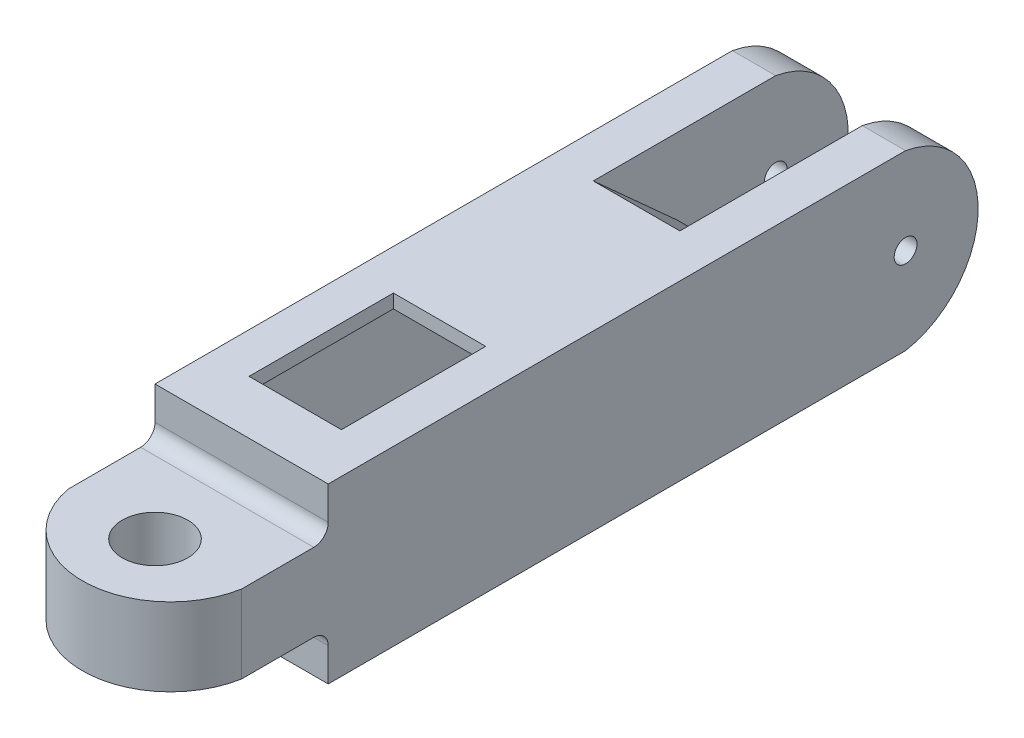
from build123d import *

# Parameters (mm, degrees)
SKETCH2_W               = 60
SKETCH2_H               = 60
BOSS_EXTRUDE1_DEPTH     = 170
SKETCH3_W               = 15
SKETCH3_H               = 60
BOSS_EXTRUDE2_DEPTH     = 30
BOSS_EXTRUDE3_DEPTH     = 15
BOSS_EXTRUDE4_START     = -15
BOSS_EXTRUDE4_DEPTH     = 15
SKETCH6_W               = 60
SKETCH6_H               = 27
BOSS_EXTRUDE5_DEPTH     = 30
BOSS_EXTRUDE6_DEPTH     = 27
CUT_EXTRUDE2_DEPTH      = 5
CUT_EXTRUDE2_DEPTH_BACK = 130
CUT_EXTRUDE2_START      = -10
SKETCH8_W               = 50.5
SKETCH8_H               = 50.5
SKETCH9_R               = 11.35
CUT_EXTRUDE3_DEPTH      = 130
SKETCH11_R              = 3.95
CUT_EXTRUDE4_DEPTH      = 232.543759953
SKETCH12_R              = 3.95
CUT_EXTRUDE5_DEPTH      = 232.543759953
CUT_EXTRUDE7_DEPTH      = 30
FILLET2_R               = 5
FILLET3_R               = 5
SKETCH16_W              = 32
SKETCH16_H              = 50
CUT_EXTRUDE8_DEPTH      = 71


with BuildPart() as part:
    # Sketch2 → Boss-Extrude1 (new body)
    with BuildSketch(Plane.XY):
        Rectangle(SKETCH2_W, SKETCH2_H)
    extrude(amount=BOSS_EXTRUDE1_DEPTH)

    # Sketch3 → Boss-Extrude2 (add)
    with BuildSketch(Plane(origin=(0, 0, 0), x_dir=(-1, 0, 0), z_dir=(0, 0, -1))):
        with Locations((22.5, 0)):
            Rectangle(SKETCH3_W, SKETCH3_H)
        with Locations((-22.5, 0)):
            Rectangle(SKETCH3_W, SKETCH3_H)
    extrude(amount=BOSS_EXTRUDE2_DEPTH)

    # Sketch4 → Boss-Extrude3 (add)
    with BuildSketch(Plane(origin=(30, 0, 0), x_dir=(0, 0, -1), z_dir=(1, 0, 0))):
        with BuildLine():
            Line((30, 30), (30, -30))
            ThreePointArc((30, -30), (55.138874415, 0), (30, 30))
        make_face()
    extrude(amount=-BOSS_EXTRUDE3_DEPTH)

    # Sketch5 → Boss-Extrude4 (add)
    with BuildSketch(Plane.ZY.offset(30).offset(BOSS_EXTRUDE4_START)):
        with BuildLine():
            Line((-30, -30), (-30, 30))
            ThreePointArc((-30, 30), (-55.138874415, 0), (-30, -30))
        make_face()
    extrude(amount=BOSS_EXTRUDE4_DEPTH)

    # Sketch6 → Boss-Extrude5 (add)
    with BuildSketch(Plane.XY.offset(170)):
        Rectangle(SKETCH6_W, SKETCH6_H)
    extrude(amount=BOSS_EXTRUDE5_DEPTH)

    # Sketch7 → Boss-Extrude6 (add)
    with BuildSketch(Plane(origin=(0, 13.5, 0), x_dir=(1, 0, 0), z_dir=(0, 1, 0))):
        with BuildLine():
            Line((30, -200), (-30, -200))
            ThreePointArc((-30, -200), (0, -225.138874415), (30, -200))
        make_face()
    extrude(amount=-BOSS_EXTRUDE6_DEPTH)

    # Sketch8 → Cut-Extrude2 (cut, two sides: drawn at the far end of the back side and taken through both)
    with BuildSketch(Plane.XY.offset(170).offset(CUT_EXTRUDE2_START - CUT_EXTRUDE2_DEPTH_BACK)):
        Rectangle(SKETCH8_W, SKETCH8_H)
    extrude(amount=CUT_EXTRUDE2_DEPTH + CUT_EXTRUDE2_DEPTH_BACK, mode=Mode.SUBTRACT)

    # Sketch9 → Cut-Extrude3 (cut)
    with BuildSketch(Plane(origin=(0, -13.5, 0), x_dir=(-1, 0, 0), z_dir=(0, -1, 0))):
        with Locations((0, -200)):
            Circle(SKETCH9_R)
    extrude(amount=-CUT_EXTRUDE3_DEPTH, mode=Mode.SUBTRACT)

    # Sketch11 → Cut-Extrude4 (cut, through all)
    with BuildSketch(Plane.ZY.offset(-15)):
        with Locations((-30, 0)):
            Circle(SKETCH11_R)
    extrude(amount=-CUT_EXTRUDE4_DEPTH, mode=Mode.SUBTRACT)

    # Sketch12 → Cut-Extrude5 (cut, through all)
    with BuildSketch(Plane(origin=(-15, 0, 0), x_dir=(0, 0, -1), z_dir=(1, 0, 0))):
        with Locations((30, 0)):
            Circle(SKETCH12_R)
    extrude(amount=-CUT_EXTRUDE5_DEPTH, mode=Mode.SUBTRACT)

    # Sketch14 → Cut-Extrude7 (cut)
    with BuildSketch(Plane(origin=(-15, 0, 0), x_dir=(0, 0, -1), z_dir=(1, 0, 0))):
        Polygon((-33.188384016, 30), (0, 0), (0, 30), align=None)
        Polygon((0, -30), (0, 0), (-33.188384016, -30), align=None)
    extrude(amount=CUT_EXTRUDE7_DEPTH, mode=Mode.SUBTRACT)

    # Fillet2
    fillet2_edges = [part.edges().sort_by_distance(p)[0] for p in [
        (0, 0, 0),
    ]]
    fillet(fillet2_edges, radius=FILLET2_R)

    # Fillet3
    fillet3_edges = [part.edges().sort_by_distance(p)[0] for p in [
        (0, -13.5, 170),
        (0, 13.5, 170),
    ]]
    fillet(fillet3_edges, radius=FILLET3_R)

    # Sketch16 → Cut-Extrude8 (cut)
    with BuildSketch(Plane(origin=(0, 30, 0), x_dir=(1, 0, 0), z_dir=(0, 1, 0))):
        with Locations((0, -126.43)):
            Rectangle(SKETCH16_W, SKETCH16_H)
    extrude(amount=-CUT_EXTRUDE8_DEPTH, mode=Mode.SUBTRACT)


solid = part.part
